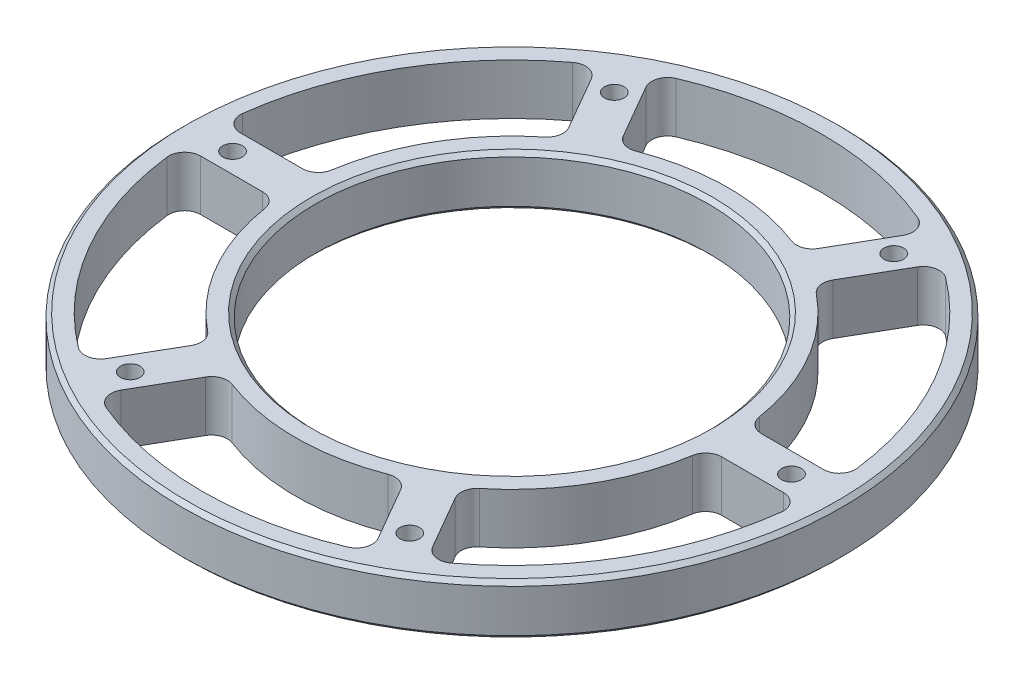
from build123d import *

# Parameters (mm, degrees)
F_10_0_1935_DIAMETER_HOLE1_D = 4.9149
CIRPATTERN3_COUNT            = 6
CUT_EXTRUDE1_DEPTH           = 118.43208675655899
FILLET1_R                    = 4
CIRPATTERN4_COUNT            = 6
FILLET1_OF_CIRPATTERN4_R     = 4
CHAMFER1_SIZE                = 1
CHAMFER2_SIZE                = 1


with BuildPart() as part:
    # Sketch2 → Revolve1 (revolve)
    with BuildSketch(Plane(origin=(0, 0, 0), x_dir=(0, 0, -1), z_dir=(1, 0, 0))):
        Polygon((-49.2125, -4.7e-16), (-82.55, -4.08e-15), (-82.55, 12.699999999999996), (-49.2125, 12.699999999999996), align=None)
    revolve(axis=Axis((0, -0.6350000000000036, 0), (0, 1, 0)))

    # #10 (0.1935) Diameter Hole1 (through all)
    with Locations(Plane(origin=(0, 12.699999999999996, 0), x_dir=(1, 0, 0), z_dir=(0, 1, 0))):
        with Locations((-35, 60.621778265)):
            f_10_0_1935_diameter_hole1 = Hole(F_10_0_1935_DIAMETER_HOLE1_D / 2)

    # CirPattern3: #10 (0.1935) Diameter Hole1 ×6 about axis
    cirpattern3_axis = Axis((0, -0.6350000000000036, 0), (0, 1, 0))
    for i in range(1, CIRPATTERN3_COUNT):
        add(f_10_0_1935_diameter_hole1.rotate(cirpattern3_axis, i * 360 / CIRPATTERN3_COUNT), mode=Mode.SUBTRACT)

    # Sketch8 → Cut-Extrude1 (cut, through all)
    with BuildSketch(Plane(origin=(0, 12.699999999999996, 0), x_dir=(1, 0, 0), z_dir=(0, 1, 0))):
        with BuildLine():
            Line((-22.660589701137386, 49.24929269184184), (-34.36419588509058, 69.52053323422602))
            ThreePointArc((-34.36419588509058, 69.52053323422602), (4.75e-15, 77.55000000000001), (34.36419588509058, 69.52053323422602))
            Line((34.36419588509058, 69.52053323422602), (22.660589701137386, 49.24929269184184))
            ThreePointArc((22.660589701137386, 49.24929269184184), (3.32e-15, 54.2125), (-22.660589701137386, 49.24929269184184))
        make_face()
    cut_extrude1 = extrude(amount=-CUT_EXTRUDE1_DEPTH, mode=Mode.SUBTRACT)

    # Fillet1
    fillet1_edges = [part.edges().sort_by_distance(p)[0] for p in [
        (-22.660589701137383, 6.349999999999998, -49.24929269184184),
        (22.66058970113739, 6.349999999999998, -49.249292691841845),
        (34.36419588509058, 6.349999999999998, -69.52053323422604),
        (-34.36419588509058, 6.349999999999998, -69.52053323422604),
    ]]
    fillet(fillet1_edges, radius=FILLET1_R)

    # CirPattern4: Cut-Extrude1 ×6 about axis
    cirpattern4_axis = Axis((0, -0.6350000000000036, 0), (0, 1, 0))
    for i in range(1, CIRPATTERN4_COUNT):
        add(cut_extrude1.rotate(cirpattern4_axis, i * 360 / CIRPATTERN4_COUNT), mode=Mode.SUBTRACT)

    # Fillet1 of CirPattern4
    fillet1_of_cirpattern4_edges = [part.edges().sort_by_distance(p)[0] for p in [
        (-53.98143344011902, 6.349999999999998, -4.9999999999999325),
        (-31.320843738981637, 6.349999999999998, -44.24929269184193),
        (-43.02444992293479, 6.349999999999998, -64.52053323422614),
        (-77.38864580802537, 6.349999999999998, -4.999999999999911),
        (-31.32084373898165, 6.349999999999998, 44.2492926918419),
        (-53.981433440119034, 6.349999999999998, 4.999999999999911),
        (-77.38864580802539, 6.349999999999998, 4.999999999999886),
        (-43.024449922934814, 6.349999999999998, 64.52053323422612),
        (22.660589701137376, 6.349999999999998, 49.24929269184184),
        (-22.660589701137397, 6.349999999999998, 49.249292691841845),
        (-34.36419588509059, 6.349999999999998, 69.52053323422604),
        (34.364195885090574, 6.349999999999998, 69.52053323422604),
        (53.98143344011902, 6.349999999999998, 4.999999999999954),
        (31.320843738981615, 6.349999999999998, 44.24929269184194),
        (43.024449922934764, 6.349999999999998, 64.52053323422615),
        (77.38864580802537, 6.349999999999998, 4.99999999999994),
        (31.320843738981637, 6.349999999999998, -44.249292691841916),
        (53.981433440119034, 6.349999999999998, -4.9999999999999325),
        (77.38864580802537, 6.349999999999998, -4.999999999999911),
        (43.02444992293479, 6.349999999999998, -64.52053323422614),
    ]]
    fillet(fillet1_of_cirpattern4_edges, radius=FILLET1_OF_CIRPATTERN4_R)

    # Chamfer1
    chamfer1_edges = [part.edges().sort_by_distance(p)[0] for p in [
        (6.03e-15, 12.699999999999996, -49.2125),
        (6.03e-15, -4.4e-16, -49.2125),
    ]]
    chamfer(chamfer1_edges, length=CHAMFER1_SIZE)

    # Chamfer2
    chamfer2_edges = [part.edges().sort_by_distance(p)[0] for p in [
        (4.677e-14, 12.699999999999996, -82.55),
        (4.677e-14, -4.11e-15, -82.55),
    ]]
    chamfer(chamfer2_edges, length=CHAMFER2_SIZE)


solid = part.part
